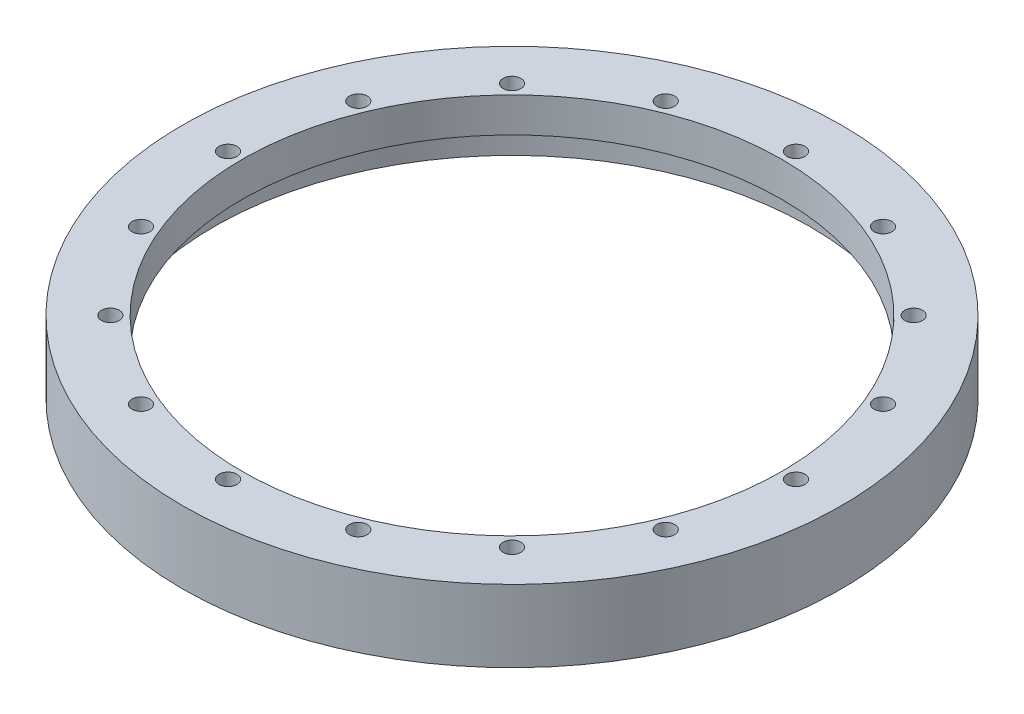
from build123d import *

# Parameters (mm, degrees)
CIRPATTERN1_COUNT = 16


with BuildPart() as part:
    # Sketch1 → Revolve1 (revolve)
    with BuildSketch(Plane.XY):
        Polygon((-49.4665, 0), (-60.3631, 0), (-60.3631, -13.208), (-54.5719, -13.208), (-54.5719, -6.35), (-49.4665, -6.35), align=None)
    revolve(axis=Axis((0, 0, 0), (0, 1, 0)))

    # Sketch3 → #4 Clearance Hole1 (revolve, cut)
    with BuildSketch(Plane(origin=(0, 0, -52.0192), x_dir=(0, 0, 1), z_dir=(1, 0, 0))):
        Polygon((0, 0), (0, 11.140574487), (1.63195, 10.16), (1.63195, 0), align=None)
    f_4_clearance_hole1 = revolve(axis=Axis((0, 6.35, -52.0192), (0, -1, 0)), mode=Mode.SUBTRACT)

    # CirPattern1: #4 Clearance Hole1 ×16 about axis
    cirpattern1_axis = Axis((0, 0, 0), (0, -1, 0))
    for i in range(1, CIRPATTERN1_COUNT):
        add(f_4_clearance_hole1.rotate(cirpattern1_axis, i * 360 / CIRPATTERN1_COUNT), mode=Mode.SUBTRACT)


solid = part.part
